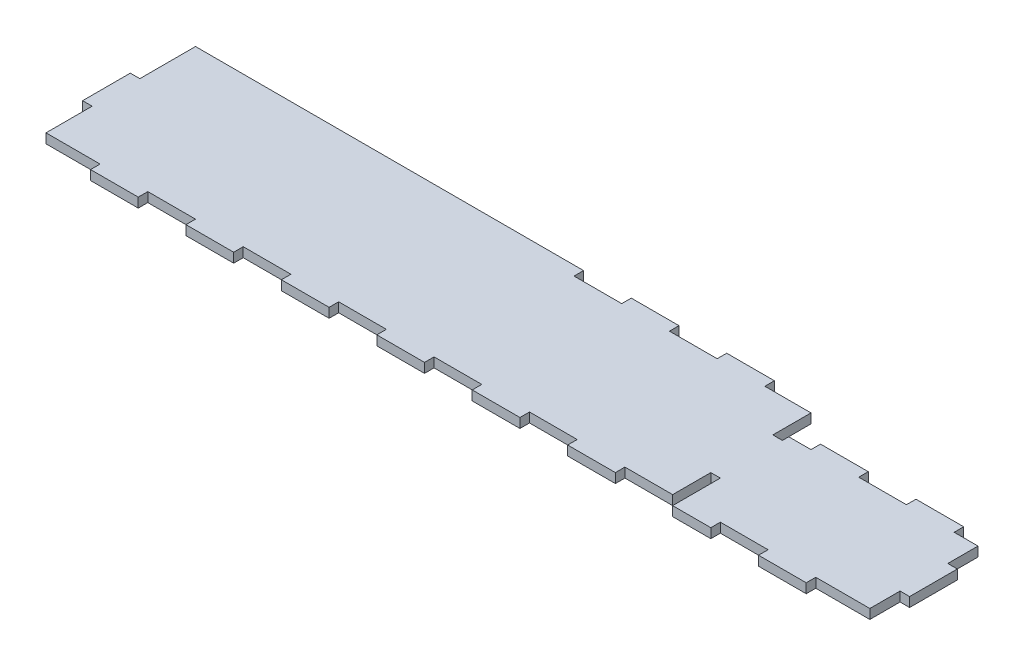
from build123d import *

# Parameters (mm, degrees)
SALIENTE_EXTRUIR1_DEPTH = 3


with BuildPart() as part:
    # Croquis1 → Saliente-Extruir1 (new body)
    with BuildSketch(Plane(origin=(0, 0, 0), x_dir=(1, 0, 0), z_dir=(0, 1, 0))):
        Polygon((125, 47), (125, 50), (110, 50), (95, 50), (80, 50), (65, 50), (50, 50), (35, 50), (20, 50), (3, 50), (3, 47), (3, 32.5), (0, 32.5), (0, 25), (0, 17.5), (3, 17.5), (3, 3), (20, 3), (20, 0), (35, 0), (35, 3), (50, 3), (50, 0), (65, 0), (65, 3), (80, 3), (80, 0), (95, 0), (95, 3), (110, 3), (110, 0), (125, 0), (125, 3), (140, 3), (140, 0), (155, 0), (155, 3), (170, 3), (170, 0), (185, 0), (185, 3), (197, 3), (200, 3), (200, 15), (203, 15), (203, 0), (215, 0), (215, 3), (230, 3), (230, 0), (245, 0), (245, 3), (262, 3), (262, 12.5), (265, 12.5), (265, 20), (265, 27.5), (262, 27.5), (262, 37), (254.5, 37), (254.5, 40), (239.5, 40), (239.5, 37), (224.5, 37), (224.5, 40), (209.5, 40), (209.5, 37), (202.5, 37), (202.5, 35), (199.5, 35), (199.5, 37), (199.5, 47), (196.5, 47), (185, 47), (185, 50), (170, 50), (170, 47), (155, 47), (155, 50), (140, 50), (140, 47), align=None)
    extrude(amount=SALIENTE_EXTRUIR1_DEPTH)


solid = part.part
